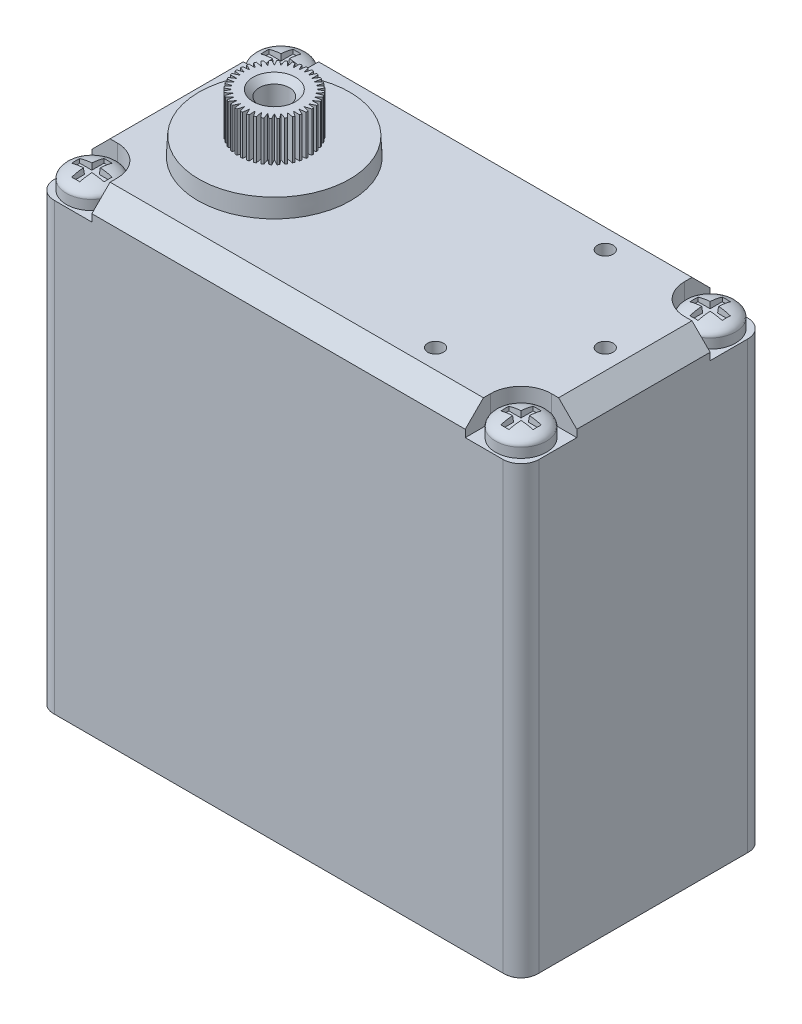
from build123d import *

# Parameters (mm, degrees)
SKETCH1_W             = 40
SKETCH1_H             = 40.3
BOSS_EXTRUDE1_DEPTH   = 10.1
SKETCH2_R             = 6.3
BOSS_EXTRUDE2_DEPTH   = 1.5
BOSS_EXTRUDE2_TAPER   = 3
SKETCH3_R             = 3
BOSS_EXTRUDE3_DEPTH   = 5.4
SKETCH9_R             = 1.2
CUT_EXTRUDE4_DEPTH    = 5
SKETCH4_R             = 6.3
BOSS_EXTRUDE4_DEPTH   = 1.5
BOSS_EXTRUDE4_TAPER   = 3
SKETCH5_R             = 2.95
BOSS_EXTRUDE5_DEPTH   = 3.3
SKETCH7_R             = 1.25
CUT_EXTRUDE2_DEPTH    = 5
CUT_EXTRUDE3_DEPTH    = 56.247262376
SKETCH10_W            = 7
SKETCH10_H            = 3.5
CUT_EXTRUDE5_DEPTH    = 4.9
SKETCH11_W            = 0.5
SKETCH11_H            = 0.5
BOSS_EXTRUDE6_DEPTH   = 3.5
BOSS_EXTRUDE6_2_DEPTH = 3.5
BOSS_EXTRUDE6_3_DEPTH = 3.5
CHAMFER4_SIZE         = 0.1
CHAMFER5_SIZE         = 0.1
CHAMFER6_SIZE         = 0.1
CIRPATTERN1_COUNT     = 40
CUT_EXTRUDE1_DEPTH    = 2.1
CHAMFER2_SIZE         = 1.5
FILLET1_R             = 1.5
FILLET2_R             = 2.1
CHAMFER1_SIZE         = 1.5
CHAMFER3_SIZE         = 0.5
FILLET3_R             = 0.5
SKETCH12_R            = 2.1
BOSS_EXTRUDE7_DEPTH   = 0.8
DOME1_FACE_RADIUS     = 2.1
DOME1_HEIGHT          = 0.8
CUT_EXTRUDE6_START    = -1.6
CUT_EXTRUDE6_DEPTH    = 0.5
CUT_EXTRUDE6_TAPER    = 5
SKETCH14_R            = 0.65
CUT_EXTRUDE7_DEPTH    = 2
SKETCH15_R            = 0.65
CUT_EXTRUDE8_DEPTH    = 2


with BuildPart() as part:
    # Sketch1 → Boss-Extrude1 (new, symmetric)
    with BuildSketch(Plane.XY):
        Rectangle(SKETCH1_W, SKETCH1_H)
    extrude(amount=BOSS_EXTRUDE1_DEPTH, both=True)

    # Sketch2 → Boss-Extrude2 (add)
    with BuildSketch(Plane.XZ.offset(20.15)):
        with Locations((-10.45, 0)):
            Circle(SKETCH2_R)
    extrude(amount=BOSS_EXTRUDE2_DEPTH, taper=BOSS_EXTRUDE2_TAPER)

    # Sketch3 → Boss-Extrude3 (add)
    with BuildSketch(Plane.XZ.offset(20.15)):
        with Locations((-10.45, 0)):
            Circle(SKETCH3_R)
    extrude(amount=BOSS_EXTRUDE3_DEPTH)

    # Sketch9 → Cut-Extrude4 (cut)
    with BuildSketch(Plane.XZ.offset(25.55)):
        with Locations((-10.45, 0)):
            Circle(SKETCH9_R)
    extrude(amount=-CUT_EXTRUDE4_DEPTH, mode=Mode.SUBTRACT)

    # Sketch4 → Boss-Extrude4 (add)
    with BuildSketch(Plane(origin=(0, 20.15, 0), x_dir=(1, 0, 0), z_dir=(0, 1, 0))):
        with Locations((-10.45, 0)):
            Circle(SKETCH4_R)
    extrude(amount=BOSS_EXTRUDE4_DEPTH, taper=BOSS_EXTRUDE4_TAPER)

    # Sketch10 → Cut-Extrude5 (cut)
    with BuildSketch(Plane.ZY.offset(20)):
        with Locations((0, -11.6)):
            Rectangle(SKETCH10_W, SKETCH10_H)
    extrude(amount=-CUT_EXTRUDE5_DEPTH, mode=Mode.SUBTRACT)

    # Sketch6 → Cut-Extrude1 (cut)
    with BuildSketch(Plane(origin=(0, 20.15, 0), x_dir=(1, 0, 0), z_dir=(0, 1, 0))):
        with BuildLine():
            Line((-20, 10.1), (-15.4, 10.1))
            Line((-15.4, 10.1), (-15.4, 8))
            ThreePointArc((-15.4, 8), (-16.132233047, 6.232233047), (-17.9, 5.5))
            Line((-17.9, 5.5), (-20, 5.5))
            Line((-20, 5.5), (-20, 10.1))
        make_face()
        with BuildLine():
            Line((15.4, 10.1), (15.4, 8))
            ThreePointArc((15.4, 8), (16.132233047, 6.232233047), (17.9, 5.5))
            Line((17.9, 5.5), (20, 5.5))
            Line((20, 5.5), (20, 10.1))
            Line((20, 10.1), (15.4, 10.1))
        make_face()
        with BuildLine():
            Line((20, -10.1), (15.4, -10.1))
            Line((15.4, -10.1), (15.4, -8))
            ThreePointArc((15.4, -8), (16.132233047, -6.232233047), (17.9, -5.5))
            Line((17.9, -5.5), (20, -5.5))
            Line((20, -5.5), (20, -10.1))
        make_face()
        with BuildLine():
            Line((-15.4, -10.1), (-15.4, -8))
            ThreePointArc((-15.4, -8), (-16.132233047, -6.232233047), (-17.9, -5.5))
            Line((-17.9, -5.5), (-20, -5.5))
            Line((-20, -5.5), (-20, -10.1))
            Line((-20, -10.1), (-15.4, -10.1))
        make_face()
    extrude(amount=-CUT_EXTRUDE1_DEPTH, mode=Mode.SUBTRACT)

    # Chamfer2
    chamfer2_edges = [part.edges().sort_by_distance(p)[0] for p in [
        (20, -20.15, 0),
        (0, -20.15, -10.1),
        (-20, -20.15, 0),
        (0, -20.15, 10.1),
    ]]
    chamfer(chamfer2_edges, length=CHAMFER2_SIZE)

    # Fillet1
    fillet1_edges = [part.edges().sort_by_distance(p)[0] for p in [
        (20, -0.3, -10.1),
        (20, -0.3, 10.1),
        (-20, -0.3, -10.1),
        (-20, -0.3, 10.1),
    ]]
    fillet(fillet1_edges, radius=FILLET1_R)

    # Fillet2
    fillet2_edges = [part.edges().sort_by_distance(p)[0] for p in [
        (-19.030330086, -19.619669914, 9.130330086),
        (19.030330086, -19.619669914, 9.130330086),
        (19.030330086, -19.619669914, -9.130330086),
        (-19.030330086, -19.619669914, -9.130330086),
    ]]
    fillet(fillet2_edges, radius=FILLET2_R)

    # Chamfer1
    chamfer1_edges = [part.edges().sort_by_distance(p)[0] for p in [
        (20, 20.15, 0),
        (-20, 20.15, 0),
        (0, 20.15, -10.1),
        (0, 20.15, 10.1),
    ]]
    chamfer(chamfer1_edges, length=CHAMFER1_SIZE)

    # Fillet3
    fillet3_edges = [part.edges().sort_by_distance(p)[0] for p in [
        (-13.45, -25.55, 0),
    ]]
    fillet(fillet3_edges, radius=FILLET3_R)

    # Sketch14 → Cut-Extrude7 (cut)
    with BuildSketch(Plane.XZ.offset(20.15)):
        with Locations((17.35, 7.5)):
            Circle(SKETCH14_R)
        with Locations((2.35, 7.5)):
            Circle(SKETCH14_R)
        with Locations((2.35, -7.5)):
            Circle(SKETCH14_R)
        with Locations((17.35, -7.5)):
            Circle(SKETCH14_R)
    extrude(amount=-CUT_EXTRUDE7_DEPTH, mode=Mode.SUBTRACT)

    # Sketch15 → Cut-Extrude8 (cut)
    with BuildSketch(Plane(origin=(0, 20.15, 0), x_dir=(1, 0, 0), z_dir=(0, 1, 0))):
        with Locations((9.85, 7)):
            Circle(SKETCH15_R)
        with Locations((16.85, 0)):
            Circle(SKETCH15_R)
        with Locations((9.85, -7)):
            Circle(SKETCH15_R)
    extrude(amount=-CUT_EXTRUDE8_DEPTH, mode=Mode.SUBTRACT)


with BuildPart() as body_2:
    # Sketch5 → Boss-Extrude5 (new body)
    with BuildSketch(Plane(origin=(0, 21.65, 0), x_dir=(1, 0, 0), z_dir=(0, 1, 0))):
        with Locations((-10.45, 0)):
            Circle(SKETCH5_R)
    extrude(amount=BOSS_EXTRUDE5_DEPTH)

    # Sketch7 → Cut-Extrude2 (cut)
    with BuildSketch(Plane(origin=(0, 24.95, 0), x_dir=(1, 0, 0), z_dir=(0, 1, 0))):
        with Locations((-10.45, 0)):
            Circle(SKETCH7_R)
    extrude(amount=-CUT_EXTRUDE2_DEPTH, mode=Mode.SUBTRACT)

    # Sketch8 → Cut-Extrude3 (cut, through all)
    with BuildSketch(Plane(origin=(0, 24.95, 0), x_dir=(1, 0, 0), z_dir=(0, 1, 0))):
        Polygon((-8, 0), (-7.5, 0.15), (-7.5, -0.15), align=None)
    cut_extrude3 = extrude(amount=-CUT_EXTRUDE3_DEPTH, mode=Mode.SUBTRACT)

    # CirPattern1: Cut-Extrude3 ×40 about axis
    cirpattern1_axis = Axis((-10.45, 24.95, 0), (0, -1, 0))
    for i in range(1, CIRPATTERN1_COUNT):
        add(cut_extrude3.rotate(cirpattern1_axis, i * 360 / CIRPATTERN1_COUNT), mode=Mode.SUBTRACT)

    # Chamfer3
    chamfer3_edges = [body_2.edges().sort_by_distance(p)[0] for p in [
        (-11.7, 24.95, 0),
    ]]
    chamfer(chamfer3_edges, length=CHAMFER3_SIZE)


with BuildPart() as body_3:
    # Sketch11 → Boss-Extrude6 (new body)
    with BuildSketch(Plane.ZY.offset(15.1)):
        with Locations((0, -12.3)):
            Rectangle(SKETCH11_W, SKETCH11_H)
    extrude(amount=BOSS_EXTRUDE6_DEPTH)

    # Chamfer5
    chamfer5_edges = [body_3.edges().sort_by_distance(p)[0] for p in [
        (-18.6, -12.55, 0),
        (-18.6, -12.3, -0.25),
        (-18.6, -12.05, 0),
        (-18.6, -12.3, 0.25),
    ]]
    chamfer(chamfer5_edges, length=CHAMFER5_SIZE)


with BuildPart() as body_4:
    # Sketch11 → Boss-Extrude6 2 (new body)
    with BuildSketch(Plane.ZY.offset(15.1)):
        with Locations((2, -12.3)):
            Rectangle(SKETCH11_W, SKETCH11_H)
    extrude(amount=BOSS_EXTRUDE6_2_DEPTH)

    # Chamfer6
    chamfer6_edges = [body_4.edges().sort_by_distance(p)[0] for p in [
        (-18.6, -12.55, 2),
        (-18.6, -12.3, 1.75),
        (-18.6, -12.05, 2),
        (-18.6, -12.3, 2.25),
    ]]
    chamfer(chamfer6_edges, length=CHAMFER6_SIZE)


with BuildPart() as body_5:
    # Sketch11 → Boss-Extrude6 3 (new body)
    with BuildSketch(Plane.ZY.offset(15.1)):
        with Locations((-2, -12.3)):
            Rectangle(SKETCH11_W, SKETCH11_H)
    extrude(amount=BOSS_EXTRUDE6_3_DEPTH)

    # Chamfer4
    chamfer4_edges = [body_5.edges().sort_by_distance(p)[0] for p in [
        (-18.6, -12.55, -2),
        (-18.6, -12.3, -2.25),
        (-18.6, -12.05, -2),
        (-18.6, -12.3, -1.75),
    ]]
    chamfer(chamfer4_edges, length=CHAMFER4_SIZE)


with BuildPart() as body_6:
    # Sketch12 → Boss-Extrude7 (new body)
    with BuildSketch(Plane(origin=(0, 18.05, 0), x_dir=(1, 0, 0), z_dir=(0, 1, 0))):
        with Locations((-17.7, 7.8)):
            Circle(SKETCH12_R)
    extrude(amount=BOSS_EXTRUDE7_DEPTH)

    # Dome1: an elliptical dome of height H over a round flat face of radius A is half a spheroid: the quarter ellipse of half axes A and H revolved about the face's axis
    with BuildSketch(Plane((-17.7, 18.85, -7.8), x_dir=(0, 0, -1), z_dir=(1, 0, 0)), mode=Mode.PRIVATE) as dome1_quarter:
        Ellipse(DOME1_FACE_RADIUS, DOME1_HEIGHT)
        Rectangle(DOME1_FACE_RADIUS, DOME1_HEIGHT, align=(Align.MIN, Align.MIN), mode=Mode.INTERSECT)
    revolve(dome1_quarter.sketch, axis=Axis((-17.7, 18.85, -7.8), (0, 1, 0)))

    # Sketch13 → Cut-Extrude6 (cut)
    with BuildSketch(Plane.XZ.offset(-18.05).offset(CUT_EXTRUDE6_START)):
        Polygon((-17.35, -7.45), (-17.35, -6.45), (-18.05, -6.45), (-18.05, -7.45), (-19.05, -7.45), (-19.05, -8.15), (-18.05, -8.15), (-18.05, -9.15), (-17.35, -9.15), (-17.35, -8.15), (-16.35, -8.15), (-16.35, -7.45), align=None)
    extrude(amount=CUT_EXTRUDE6_DEPTH, taper=CUT_EXTRUDE6_TAPER, mode=Mode.SUBTRACT)


with BuildPart() as body_7:
    # Mirror1: mirrored copy
    add(body_6.part.mirror(Plane(origin=(0, 0, 0), x_dir=(0, 0, 1), z_dir=(1, 0, 0))))


with BuildPart() as body_8:
    # Mirror2: mirrored copy
    add(body_7.part.mirror(Plane.XY))


with BuildPart() as body_9:
    # Mirror2 2: mirrored copy
    add(body_6.part.mirror(Plane.XY))


solid = Compound([part.part, body_2.part, body_3.part, body_4.part, body_5.part, body_6.part, body_7.part, body_8.part, body_9.part])
